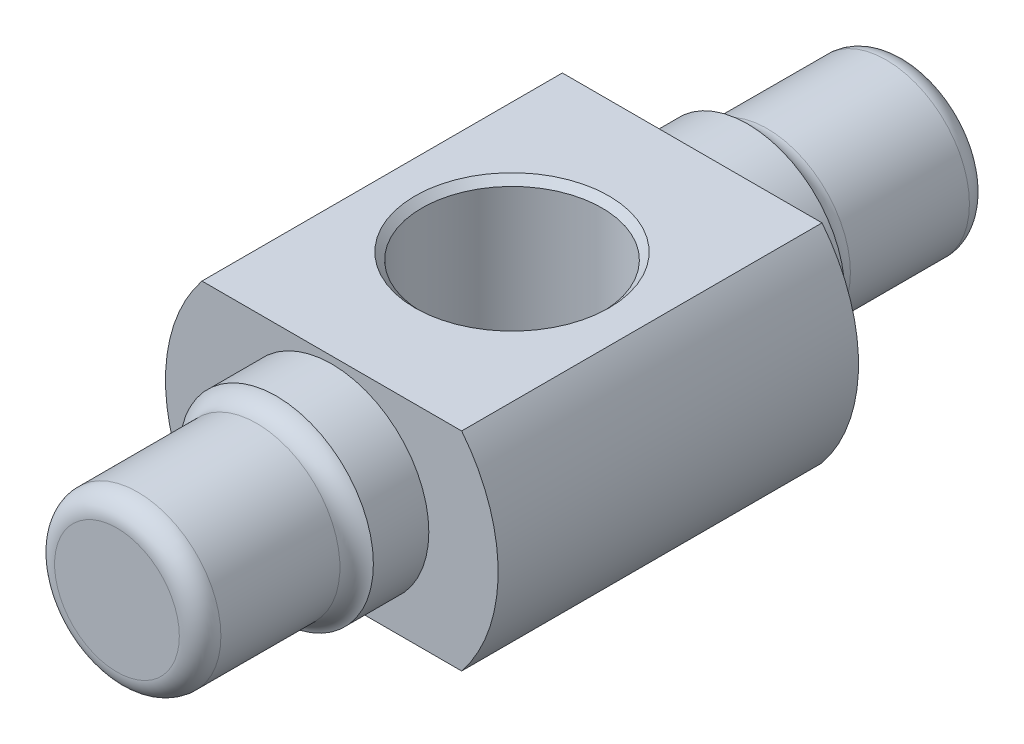
from build123d import *

# Parameters (mm, degrees)
SKETCH1_W           = 18.734993996
SKETCH1_H           = 15
BOSS_EXTRUDE1_DEPTH = 26
SKETCH2_R           = 6.5
CUT_EXTRUDE1_DEPTH  = 33.32645975
CHAMFER1_SIZE       = 0.5
SKETCH3_R           = 7
BOSS_EXTRUDE2_DEPTH = 4
SKETCH4_R           = 6
BOSS_EXTRUDE3_DEPTH = 11.5
FILLET1_R           = 1.5


with BuildPart() as part:
    # Sketch1 → Boss-Extrude1 (new body)
    with BuildSketch(Plane.XY):
        Rectangle(SKETCH1_W, SKETCH1_H)
        with BuildLine():
            ThreePointArc((-9.367496998, 7.5), (-12, 0), (-9.367496998, -7.5))
            Line((-9.367496998, -7.5), (-9.367496998, 7.5))
        make_face()
        with BuildLine():
            Line((9.367496998, 7.5), (9.367496998, -7.5))
            ThreePointArc((9.367496998, -7.5), (11.322763885, -3.974294656), (12, 0))
            ThreePointArc((12, 0), (11.322763885, 3.974294656), (9.367496998, 7.5))
        make_face()
    extrude(amount=BOSS_EXTRUDE1_DEPTH)

    # Sketch2 → Cut-Extrude1 (cut, through all)
    with BuildSketch(Plane(origin=(0, 7.5, 0), x_dir=(1, 0, 0), z_dir=(0, 1, 0))):
        with Locations(Location((0, -13, 0), (0, 0, 270))):
            Circle(SKETCH2_R)
    extrude(amount=-CUT_EXTRUDE1_DEPTH, mode=Mode.SUBTRACT)

    # Chamfer1
    chamfer1_edges = [part.edges().sort_by_distance(p)[0] for p in [
        (0, -7.5, 6.5),
        (0, 7.5, 6.5),
    ]]
    chamfer(chamfer1_edges, length=CHAMFER1_SIZE)

    # Sketch3 → Boss-Extrude2 (add)
    with BuildSketch(Plane.XY.offset(26)):
        Circle(SKETCH3_R)
    extrude(amount=BOSS_EXTRUDE2_DEPTH)

    # Sketch4 → Boss-Extrude3 (add)
    with BuildSketch(Plane.XY.offset(30)):
        Circle(SKETCH4_R)
    extrude(amount=BOSS_EXTRUDE3_DEPTH)

    # Fillet1
    # the kernel refuses this fillet: 1.5 mm, written as the material it adds along each edge
    with BuildSketch(Plane(origin=(0, 0, 30), x_dir=(1, 0, 0), z_dir=(0, -1, 0))) as fillet1_piece_1:
        with BuildLine():
            CenterArc((7.5, 1.414213562), FILLET1_R, 180, 70.528779366)
            Line((6, 1.414213562), (6, 0))
            Line((6, 0), (7, 0))
        make_face()
    revolve(axis=Axis((0, 0, 30), (0, 0, 1)))
    # the kernel refuses this fillet: 1.5 mm, written as the material it takes off along each edge
    with BuildSketch(Plane(origin=(0, 0, 41.5), x_dir=(1, 0, 0), z_dir=(0, -1, 0))) as fillet1_2_piece_1:
        with BuildLine():
            CenterArc((6 - FILLET1_R, -FILLET1_R), FILLET1_R, 0, 90)
            Line((6 - FILLET1_R, 0), (6, 0))
            Line((6, 0), (6, -FILLET1_R))
        make_face()
    revolve(axis=Axis((0, 0, 41.5), (0, 0, 1)), mode=Mode.SUBTRACT)

    # Mirror1: read off the stored shape, not the designer's step
    # Mirror1 outline → Mirror1 (revolve)
    with BuildSketch(Plane.XZ):
        with BuildLine():
            ThreePointArc((6, -5.414213562), (6.275255129, -4.548188159), (7, -4))
            Line((7, -4), (7, 0))
            Line((7, 0), (0, 0))
            Line((0, 0), (0, -15.5))
            Line((0, -15.5), (4.5, -15.5))
            ThreePointArc((4.5, -15.5), (5.560660172, -15.060660172), (6, -14))
            Line((6, -14), (6, -5.414213562))
        make_face()
    revolve(axis=Axis((0, 0, 0), (0, 0, 1)))


solid = part.part
